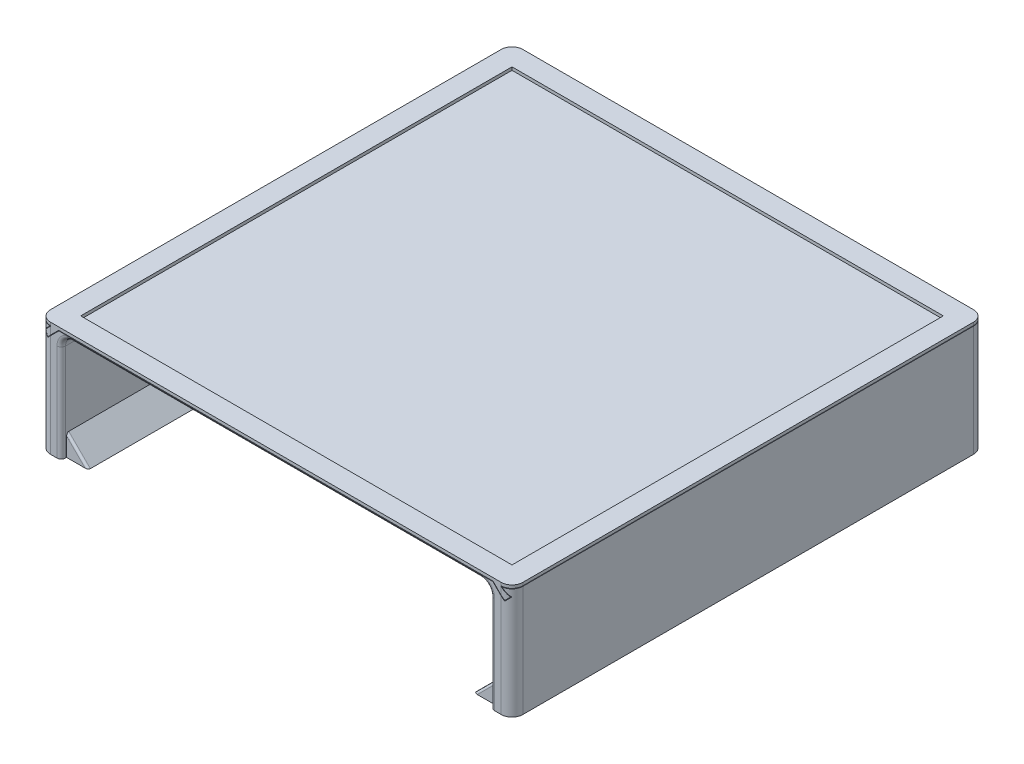
from build123d import *

# Parameters (mm, degrees)
BOSS_EXTRUDE1_DEPTH  = 109.5
BOSS_EXTRUDE2_DEPTH  = 109.5
SKETCH2_W            = 200
SKETCH2_H            = 200
CUT_EXTRUDE1_DEPTH   = 164.258659801
FILLET1_R            = 5
SKETCH3_W            = 199
SKETCH3_H            = 50
BOSS_EXTRUDE3_DEPTH  = 5
FILLET2_R            = 5
SKETCH9_W            = 379
SKETCH9_H            = 379
CUT_EXTRUDE3_DEPTH   = 164.707391403
FILLET4_R            = 2
FILLET5_R            = 1
BOSS_EXTRUDE6_DEPTH  = 107
FILLET6_R            = 1
FILLET6_OF_MIRROR1_R = 1


with BuildPart() as part:
    # Sketch1 → Boss-Extrude1 (new, symmetric)
    with BuildSketch(Plane.XY):
        Polygon((-99.5, -1.5), (99.5, -1.5), (99.5, -51.5), (109.5, -51.5), (109.5, 0), (104.717157288, 0), (108, -3.282842712), (105.949390335, -5.333452378), (100.615937957, 0), (-100.615937957, 0), (-105.949390335, -5.333452378), (-108, -3.282842712), (-104.717157288, 0), (-109.5, 0), (-109.5, -51.5), (-99.5, -51.5), align=None)
    extrude(amount=BOSS_EXTRUDE1_DEPTH, both=True)

    # Fillet1
    fillet1_edges = [part.edges().sort_by_distance(p)[0] for p in [
        (99.5, -1.5, 0),
        (-99.5, -1.5, 0),
    ]]
    fillet(fillet1_edges, radius=FILLET1_R)

    # Sketch3 → Boss-Extrude3 (add, symmetric)
    with BuildSketch(Plane.XY):
        with Locations((0, -26.5)):
            Rectangle(SKETCH3_W, SKETCH3_H)
    extrude(amount=BOSS_EXTRUDE3_DEPTH, both=True)

    # Fillet2
    fillet2_edges = [part.edges().sort_by_distance(p)[0] for p in [
        (-109.5, -25.75, 109.5),
        (-109.5, -25.75, -109.5),
        (109.5, -25.75, -109.5),
        (109.5, -25.75, 109.5),
    ]]
    fillet(fillet2_edges, radius=FILLET2_R)

    # Fillet4
    fillet4_edges = [part.edges().sort_by_distance(p)[0] for p in [
        (-99.5, -29, 109.5),
        (-98.035533906, -2.964466094, 109.5),
        (99.5, -29, 109.5),
        (98.035533906, -2.964466094, 109.5),
        (-99.5, -29, -109.5),
        (-98.035533906, -2.964466094, -109.5),
        (99.5, -29, -109.5),
        (98.035533906, -2.964466094, -109.5),
        (0, -1.5, 109.5),
        (0, -1.5, -109.5),
    ]]
    fillet(fillet4_edges, radius=FILLET4_R)

    # Fillet5
    fillet5_edges = [part.edges().sort_by_distance(p)[0] for p in [
        (-99.5, -29, -5),
        (-98.035533906, -2.964466094, -5),
        (0, -1.5, -5),
        (98.035533906, -2.964466094, -5),
        (-99.5, -29, 5),
        (-98.035533906, -2.964466094, 5),
        (0, -1.5, 5),
        (98.035533906, -2.964466094, 5),
        (99.5, -29, -5),
        (99.5, -29, 5),
    ]]
    fillet(fillet5_edges, radius=FILLET5_R)

    # Sketch6 → Boss-Extrude6 (add, symmetric)
    with BuildSketch(Plane.XY):
        Polygon((-99.5, -51.5), (-89.5, -51.5), (-99.5, -41.5), align=None)
    boss_extrude6 = extrude(amount=BOSS_EXTRUDE6_DEPTH, both=True)

    # Fillet6
    fillet6_edges = [part.edges().sort_by_distance(p)[0] for p in [
        (-94.5, -46.5, 107),
        (-94.5, -46.5, -107),
    ]]
    fillet(fillet6_edges, radius=FILLET6_R)

    # Mirror1: Boss-Extrude6 across plane
    add(boss_extrude6.mirror(Plane(origin=(0, 0, 0), x_dir=(0, 0, 1), z_dir=(1, 0, 0))))

    # Fillet6 of Mirror1
    fillet6_of_mirror1_edges = [part.edges().sort_by_distance(p)[0] for p in [
        (94.5, -46.5, 107),
        (94.5, -46.5, -107),
    ]]
    fillet(fillet6_of_mirror1_edges, radius=FILLET6_OF_MIRROR1_R)


with BuildPart() as body_2:
    # Sketch1<4> → Boss-Extrude2 (new, symmetric)
    with BuildSketch(Plane.XY):
        Polygon((-109.5, 0.2), (-104.234314575, 0.2), (-107.717157288, -3.282842712), (-105.949390335, -5.050609665), (-100.698780669, 0.2), (100.698780669, 0.2), (105.949390335, -5.050609665), (107.717157288, -3.282842712), (104.234314575, 0.2), (109.5, 0.2), (109.5, 1.6), (-109.5, 1.6), align=None)
    extrude(amount=BOSS_EXTRUDE2_DEPTH, both=True)

    # Sketch2 → Cut-Extrude1 (cut, through all)
    with BuildSketch(Plane.XZ.offset(-0.2)):
        Rectangle(SKETCH2_W, SKETCH2_H)
    extrude(amount=-CUT_EXTRUDE1_DEPTH, mode=Mode.SUBTRACT)

    # Sketch9 → Cut-Extrude3 (cut, through all)
    with BuildSketch(Plane.XZ.offset(51.5)):
        Rectangle(SKETCH9_W, SKETCH9_H)
        with BuildLine():
            ThreePointArc((109.5, -104.5), (108.035533906, -108.035533906), (104.5, -109.5))
            Line((104.5, -109.5), (99.5, -109.5))
            Line((99.5, -109.5), (-99.5, -109.5))
            Line((-99.5, -109.5), (-104.5, -109.5))
            ThreePointArc((-104.5, -109.5), (-108.035533906, -108.035533906), (-109.5, -104.5))
            Line((-109.5, -104.5), (-109.5, 104.5))
            ThreePointArc((-109.5, 104.5), (-108.035533906, 108.035533906), (-104.5, 109.5))
            Line((-104.5, 109.5), (-99.5, 109.5))
            Line((-99.5, 109.5), (99.5, 109.5))
            Line((99.5, 109.5), (104.5, 109.5))
            ThreePointArc((104.5, 109.5), (108.035533906, 108.035533906), (109.5, 104.5))
            Line((109.5, 104.5), (109.5, -104.5))
        make_face(mode=Mode.SUBTRACT)
    extrude(amount=-CUT_EXTRUDE3_DEPTH, mode=Mode.SUBTRACT)


solid = Compound([part.part, body_2.part])
